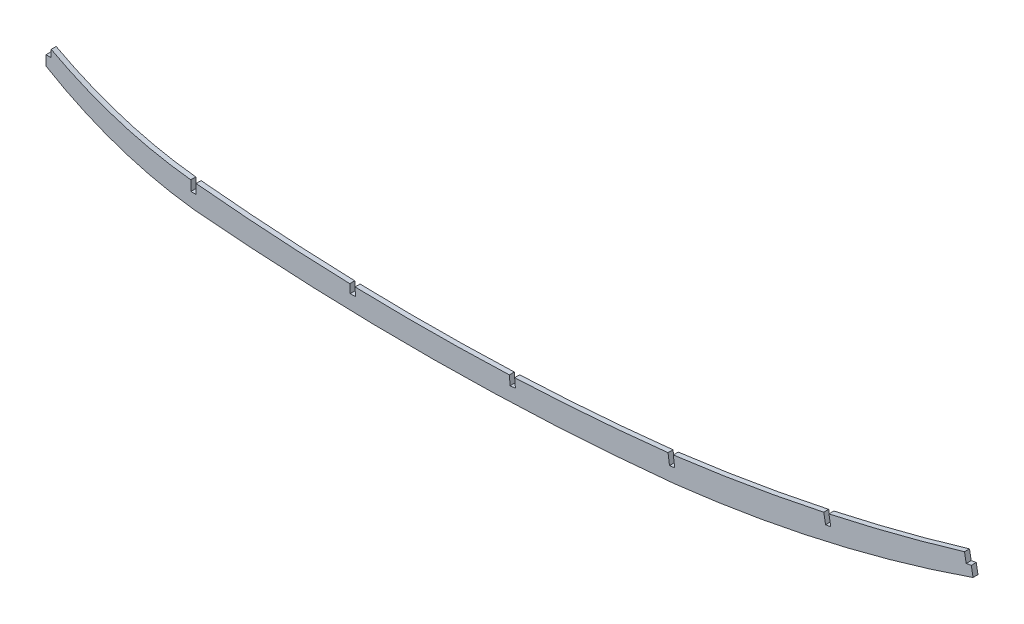
from build123d import *

# Parameters (mm, degrees)
BOSS_EXTRUDE1_DEPTH = 3.175
SKETCH3_W           = 3.3782
SKETCH3_H           = 9.116578424
CUT_EXTRUDE2_DEPTH  = 606.636541674


with BuildPart() as part:
    # Sketch2 → Boss-Extrude1 (new body)
    with BuildSketch(Plane.XY):
        with BuildLine():
            Line((0, -81.769447024), (0, -94.469447024))
            ThreePointArc((0, -94.469447024), (45.293757409, -115.460746442), (93.98, -126.497453101))
            ThreePointArc((93.98, -126.497453101), (247.132802315, -132.883361709), (400.203586987, -124.765753327))
            ThreePointArc((400.203586987, -124.765753327), (496.73811025, -108.348158667), (590.864339182, -81.353629169))
            Line((590.864339182, -81.353629169), (588.593285498, -68.858337449))
            ThreePointArc((588.593285498, -68.858337449), (494.24795915, -93.166461028), (398.184073829, -109.403930433))
            ThreePointArc((398.184073829, -109.403930433), (246.131127604, -118.387559898), (93.98, -111.257453101))
            ThreePointArc((93.98, -111.257453101), (45.478698707, -101.330055673), (0, -81.769447024))
        make_face()
    extrude(amount=BOSS_EXTRUDE1_DEPTH)

    # Sketch3 → Cut-Extrude2 (cut, through all)
    with BuildSketch(Plane.XY.offset(3.175)):
        Polygon((0, -81.823651503), (0, -88.181271503), (3.302, -88.181271503), (3.302, -81.823651503), (3.302, -80.849253243), (0, -80.849253243), align=None)
        with Locations((93.98, -112.972963904)):
            Rectangle(SKETCH3_W, SKETCH3_H)
        Polygon((183.426070396, 128.229599916), (183.158711139, 134.615096468), (186.330931782, 134.747916609), (186.598291039, 128.362420058), align=None)
        Polygon((193.849633474, -123.151114373), (197.224876239, -123.009793743), (196.926348208, -115.879875231), (193.551105443, -116.021195861), align=None)
        Polygon((397.375099539, -116.299780406), (400.723885221, -115.854954941), (399.211318768, -104.467880056), (395.862533086, -104.912705522), align=None)
        Polygon((295.823280702, -123.008827736), (299.189034058, -122.719104443), (298.52739573, -115.032765525), (295.161642374, -115.322488818), align=None)
        Polygon((586.515324681, -75.768921214), (589.838721446, -75.162893837), (588.533193274, -68.003500927), (585.209796509, -68.609528304), align=None)
        Polygon((496.875793957, -99.221011682), (500.199190722, -98.614984306), (498.73195058, -90.568778264), (495.408553815, -91.174805641), align=None)
    extrude(amount=-CUT_EXTRUDE2_DEPTH, mode=Mode.SUBTRACT)


solid = part.part
